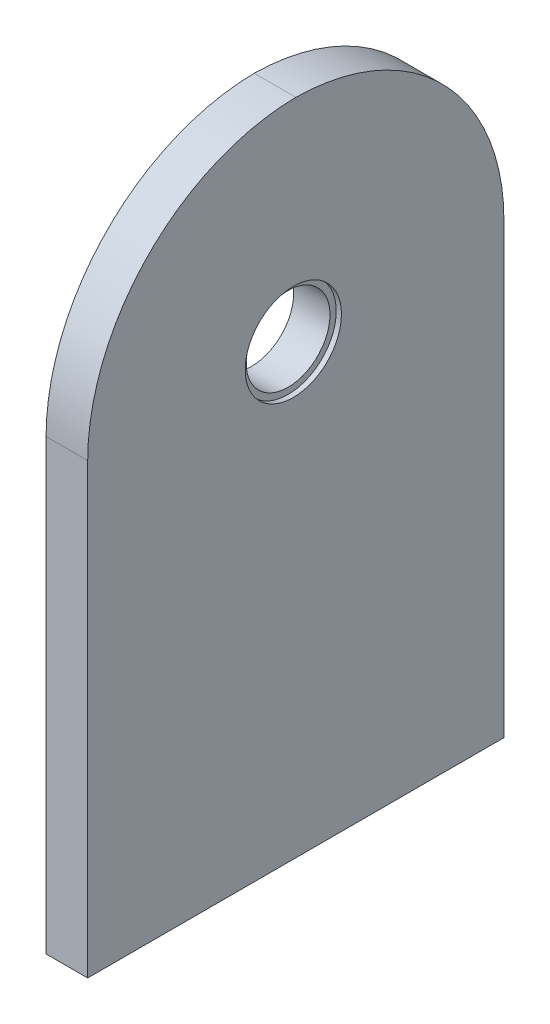
from build123d import *

# Parameters (mm, degrees)
STOCK_NEW_TRACKER_1_START = 60
STOCK_NEW_TRACKER_1_DEPTH = 8
SKETCH1_R                 = 9.25
CUT_EXTRUDE1_DEPTH        = 1
SKETCH2_R                 = 8.05
CUT_EXTRUDE2_DEPTH        = 143.502485249
M4X0_7_TAPPED_HOLE1_D     = 3.3
M4X0_7_TAPPED_HOLE1_DEPTH = 35
M4X0_7_TAPPED_HOLE1_TIP   = 0.991420021


# Read off the part's stored shape, not the designer's step: Stock-New_Tracker-1
with BuildPart() as part:
    # Stock-New_Tracker-1 outline → Stock-New_Tracker-1 (new body)
    with BuildSketch(Plane.YZ.offset(STOCK_NEW_TRACKER_1_START)):
        with BuildLine():
            Line((10, 40), (10, -40))
            Line((10, -40), (96.116983094, -40))
            ThreePointArc((96.116983094, -40), (124.570453884, -28.312888011), (136.594137144, 0))
            ThreePointArc((136.594137144, 0), (124.570453884, 28.312888011), (96.116983094, 40))
            Line((96.116983094, 40), (10, 40))
        make_face()
    extrude(amount=STOCK_NEW_TRACKER_1_DEPTH)

    # Sketch1 → Cut-Extrude1 (cut)
    with BuildSketch(Plane(origin=(68, 0, 0), x_dir=(0, 0, -1), z_dir=(1, 0, 0))):
        with Locations((-0.48, 96.116983094)):
            Circle(SKETCH1_R)
    extrude(amount=-CUT_EXTRUDE1_DEPTH, mode=Mode.SUBTRACT)

    # Sketch2 → Cut-Extrude2 (cut, through all)
    with BuildSketch(Plane(origin=(67, 0, 0), x_dir=(0, 0, -1), z_dir=(1, 0, 0))):
        with Locations((-0.48, 96.116983094)):
            Circle(SKETCH2_R)
    extrude(amount=-CUT_EXTRUDE2_DEPTH, mode=Mode.SUBTRACT)

    # M4x0.7 Tapped Hole1
    with Locations(Plane(origin=(0, 10, 0), x_dir=(-1, 0, 0), z_dir=(0, -1, 0))):
        with Locations((-64, -30), (-64, 0), (-64, 30)):
            Hole(M4X0_7_TAPPED_HOLE1_D / 2, depth=M4X0_7_TAPPED_HOLE1_DEPTH)
            with Locations((0, 0, -(M4X0_7_TAPPED_HOLE1_DEPTH + M4X0_7_TAPPED_HOLE1_TIP / 2))):  # 118° drill point
                Cone(0, M4X0_7_TAPPED_HOLE1_D / 2, M4X0_7_TAPPED_HOLE1_TIP, mode=Mode.SUBTRACT)


solid = part.part
